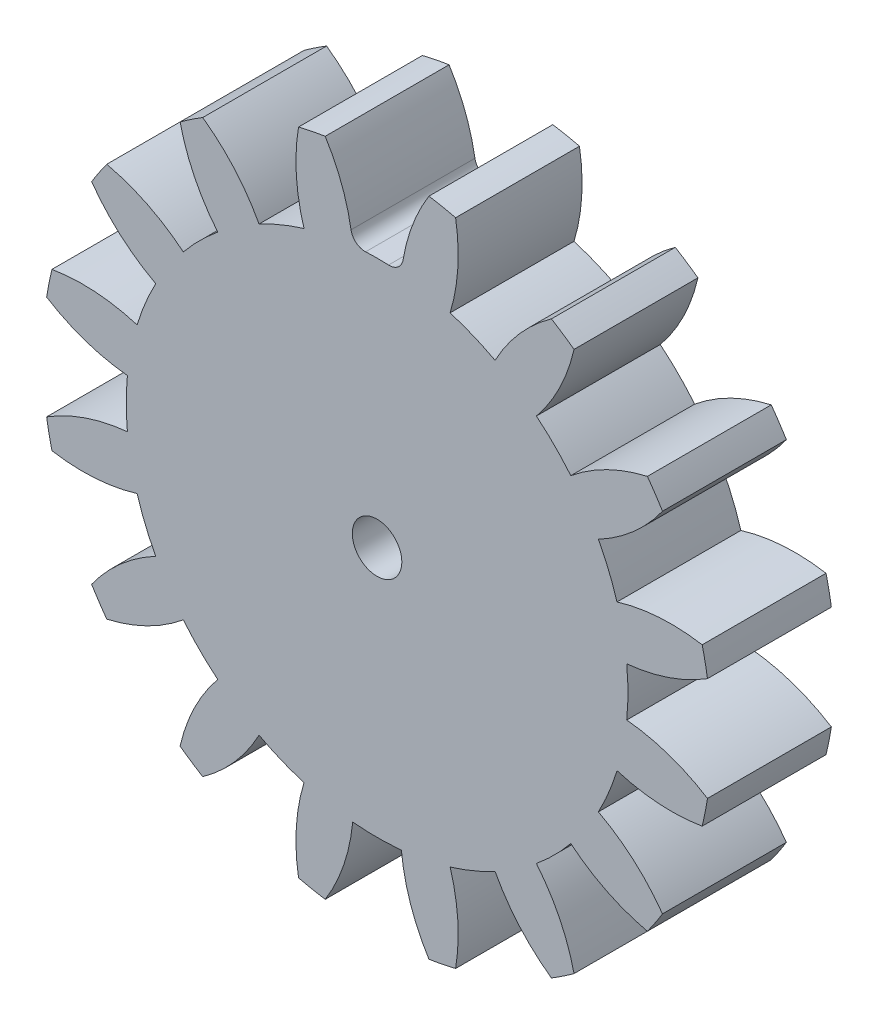
from build123d import *

# Parameters (mm, degrees)
SKETCH1_R           = 13.5
SKETCH1_R_2         = 1
BOSS_EXTRUDE1_DEPTH = 2.5
CUT_EXTRUDE1_DEPTH  = 20.254869514
FILLET1_R           = 0.57
CIRPATTERN3_COUNT   = 16


with BuildPart() as part:
    # Sketch1 → Boss-Extrude1 (new, symmetric)
    with BuildSketch(Plane.XY):
        Circle(SKETCH1_R)
        Circle(SKETCH1_R_2, mode=Mode.SUBTRACT)
    extrude(amount=BOSS_EXTRUDE1_DEPTH, both=True)

    # Sketch2 → Cut-Extrude1 (cut, symmetric)
    with BuildSketch(Plane.XY):
        with BuildLine():
            ThreePointArc((0.982234387, 10.077243701), (0, 10.125), (-0.982234387, 10.077243701))
            ThreePointArc((-0.982234387, 10.077243701), (-1.348268622, 11.771504161), (-2.092826994, 13.336794037))
            ThreePointArc((-2.092826994, 13.336794037), (0, 13.5), (2.092826994, 13.336794037))
            ThreePointArc((2.092826994, 13.336794037), (1.348268622, 11.771504161), (0.982234387, 10.077243701))
        make_face()
    cut_extrude1 = extrude(amount=CUT_EXTRUDE1_DEPTH, both=True, mode=Mode.SUBTRACT)

    # Fillet1
    fillet1_edges = [part.edges().sort_by_distance(p)[0] for p in [
        (0.982234387, 10.077243701, 0),
        (-0.982234387, 10.077243701, 0),
    ]]
    fillet(fillet1_edges, radius=FILLET1_R)

    # CirPattern3: Cut-Extrude1 ×16 about axis
    cirpattern3_axis = Axis((0, 0, 2.5), (0, 0, -1))
    for i in range(1, CIRPATTERN3_COUNT):
        add(cut_extrude1.rotate(cirpattern3_axis, i * 360 / CIRPATTERN3_COUNT), mode=Mode.SUBTRACT)


solid = part.part
